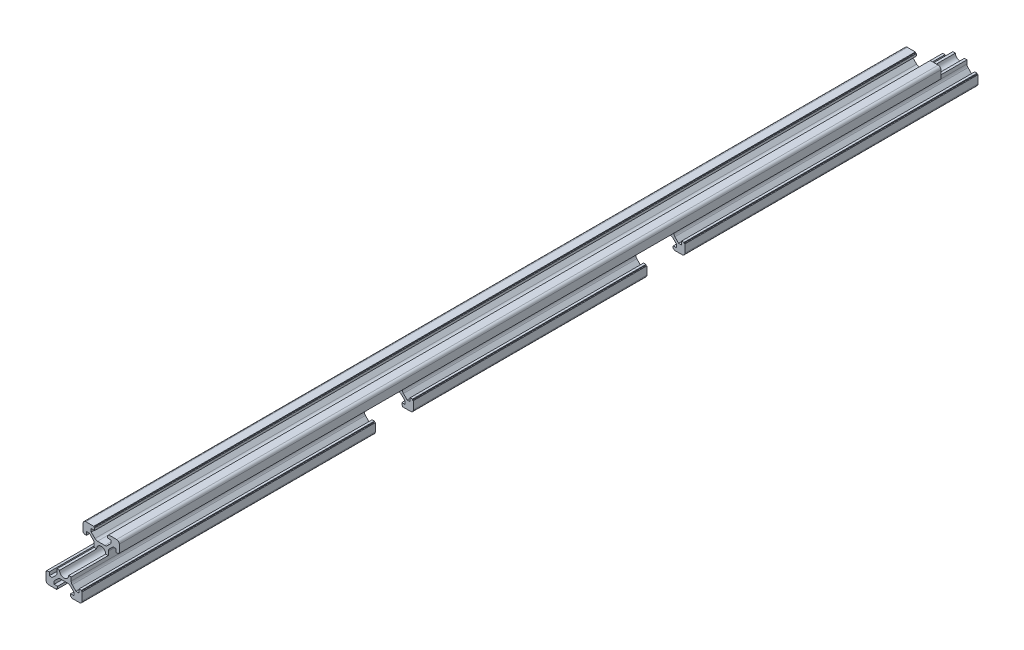
from build123d import *

# Parameters (mm, degrees)
SKETCH1_R           = 2.5
BOSS_EXTRUDE2_DEPTH = 495
SKETCH_1_W          = 21
SKETCH_1_H          = 10
SKETCH_1_W_2        = 20.5
CUT_EXTRUDE_1_DEPTH = 496.504793115


with BuildPart() as part:
    # Sketch1 → Boss-Extrude2 (new body)
    with BuildSketch(Plane.XY):
        with BuildLine():
            Line((10, -8.5), (10, -4.1))
            Line((10, -4.1), (9.5, -4.1))
            Line((9.5, -4.1), (9.5, -3.6))
            Line((9.5, -3.6), (8.2, -3.6))
            Line((8.2, -3.6), (8.2, -5.5))
            Line((8.2, -5.5), (6.560660172, -5.5))
            Line((6.560660172, -5.5), (4.485786438, -3.425126266))
            ThreePointArc((4.485786438, -3.425126266), (4.052240935, -2.776279568), (3.9, -2.010912703))
            Line((3.9, -2.010912703), (3.9, 2.010912703))
            ThreePointArc((3.9, 2.010912703), (4.052240935, 2.776279568), (4.485786438, 3.425126266))
            Line((4.485786438, 3.425126266), (6.560660172, 5.5))
            Line((6.560660172, 5.5), (8.2, 5.5))
            Line((8.2, 5.5), (8.2, 3.6))
            Line((8.2, 3.6), (9.5, 3.6))
            Line((9.5, 3.6), (9.5, 4.1))
            Line((9.5, 4.1), (10, 4.1))
            Line((10, 4.1), (10, 8.5))
            ThreePointArc((10, 8.5), (9.560660172, 9.560660172), (8.5, 10))
            Line((8.5, 10), (4.1, 10))
            Line((4.1, 10), (4.1, 9.5))
            Line((4.1, 9.5), (3.6, 9.5))
            Line((3.6, 9.5), (3.6, 8.2))
            Line((3.6, 8.2), (5.5, 8.2))
            Line((5.5, 8.2), (5.5, 6.560660172))
            Line((5.5, 6.560660172), (3.425126266, 4.485786438))
            ThreePointArc((3.425126266, 4.485786438), (2.776279568, 4.052240935), (2.010912703, 3.9))
            Line((2.010912703, 3.9), (-2.010912703, 3.9))
            ThreePointArc((-2.010912703, 3.9), (-2.776279568, 4.052240935), (-3.425126266, 4.485786438))
            Line((-3.425126266, 4.485786438), (-5.5, 6.560660172))
            Line((-5.5, 6.560660172), (-5.5, 8.2))
            Line((-5.5, 8.2), (-3.6, 8.2))
            Line((-3.6, 8.2), (-3.6, 9.5))
            Line((-3.6, 9.5), (-4.1, 9.5))
            Line((-4.1, 9.5), (-4.1, 10))
            Line((-4.1, 10), (-8.5, 10))
            ThreePointArc((-8.5, 10), (-9.560660172, 9.560660172), (-10, 8.5))
            Line((-10, 8.5), (-10, 4.1))
            Line((-10, 4.1), (-9.5, 4.1))
            Line((-9.5, 4.1), (-9.5, 3.6))
            Line((-9.5, 3.6), (-8.2, 3.6))
            Line((-8.2, 3.6), (-8.2, 5.5))
            Line((-8.2, 5.5), (-6.560660172, 5.5))
            Line((-6.560660172, 5.5), (-4.485786438, 3.425126266))
            ThreePointArc((-4.485786438, 3.425126266), (-4.052240935, 2.776279568), (-3.9, 2.010912703))
            Line((-3.9, 2.010912703), (-3.9, -2.010912703))
            ThreePointArc((-3.9, -2.010912703), (-4.052240935, -2.776279568), (-4.485786438, -3.425126266))
            Line((-4.485786438, -3.425126266), (-6.560660172, -5.5))
            Line((-6.560660172, -5.5), (-8.2, -5.5))
            Line((-8.2, -5.5), (-8.2, -3.6))
            Line((-8.2, -3.6), (-9.5, -3.6))
            Line((-9.5, -3.6), (-9.5, -4.1))
            Line((-9.5, -4.1), (-10, -4.1))
            Line((-10, -4.1), (-10, -8.5))
            ThreePointArc((-10, -8.5), (-9.560660172, -9.560660172), (-8.5, -10))
            Line((-8.5, -10), (-4.1, -10))
            Line((-4.1, -10), (-4.1, -9.5))
            Line((-4.1, -9.5), (-3.6, -9.5))
            Line((-3.6, -9.5), (-3.6, -8.2))
            Line((-3.6, -8.2), (-5.5, -8.2))
            Line((-5.5, -8.2), (-5.5, -6.560660172))
            Line((-5.5, -6.560660172), (-3.425126266, -4.485786438))
            ThreePointArc((-3.425126266, -4.485786438), (-2.776279568, -4.052240935), (-2.010912703, -3.9))
            Line((-2.010912703, -3.9), (2.010912703, -3.9))
            ThreePointArc((2.010912703, -3.9), (2.776279568, -4.052240935), (3.425126266, -4.485786438))
            Line((3.425126266, -4.485786438), (5.5, -6.560660172))
            Line((5.5, -6.560660172), (5.5, -8.2))
            Line((5.5, -8.2), (3.6, -8.2))
            Line((3.6, -8.2), (3.6, -9.5))
            Line((3.6, -9.5), (4.1, -9.5))
            Line((4.1, -9.5), (4.1, -10))
            Line((4.1, -10), (8.5, -10))
            ThreePointArc((8.5, -10), (9.560660172, -9.560660172), (10, -8.5))
        make_face()
        Circle(SKETCH1_R, mode=Mode.SUBTRACT)
    extrude(amount=BOSS_EXTRUDE2_DEPTH)

    # ｽｹｯﾁ1 → ｶｯﾄ - 押し出し1 (cut, through all)
    with BuildSketch(Plane.ZY.offset(10)):
        with Locations((172.5, -5)):
            Rectangle(SKETCH_1_W, SKETCH_1_H)
        with Locations((10.25, 5)):
            Rectangle(SKETCH_1_W_2, SKETCH_1_H)
        with Locations((484.75, 5)):
            Rectangle(SKETCH_1_W_2, SKETCH_1_H)
        with Locations((322.5, -5)):
            Rectangle(SKETCH_1_W, SKETCH_1_H)
    extrude(amount=-CUT_EXTRUDE_1_DEPTH, mode=Mode.SUBTRACT)


solid = part.part
